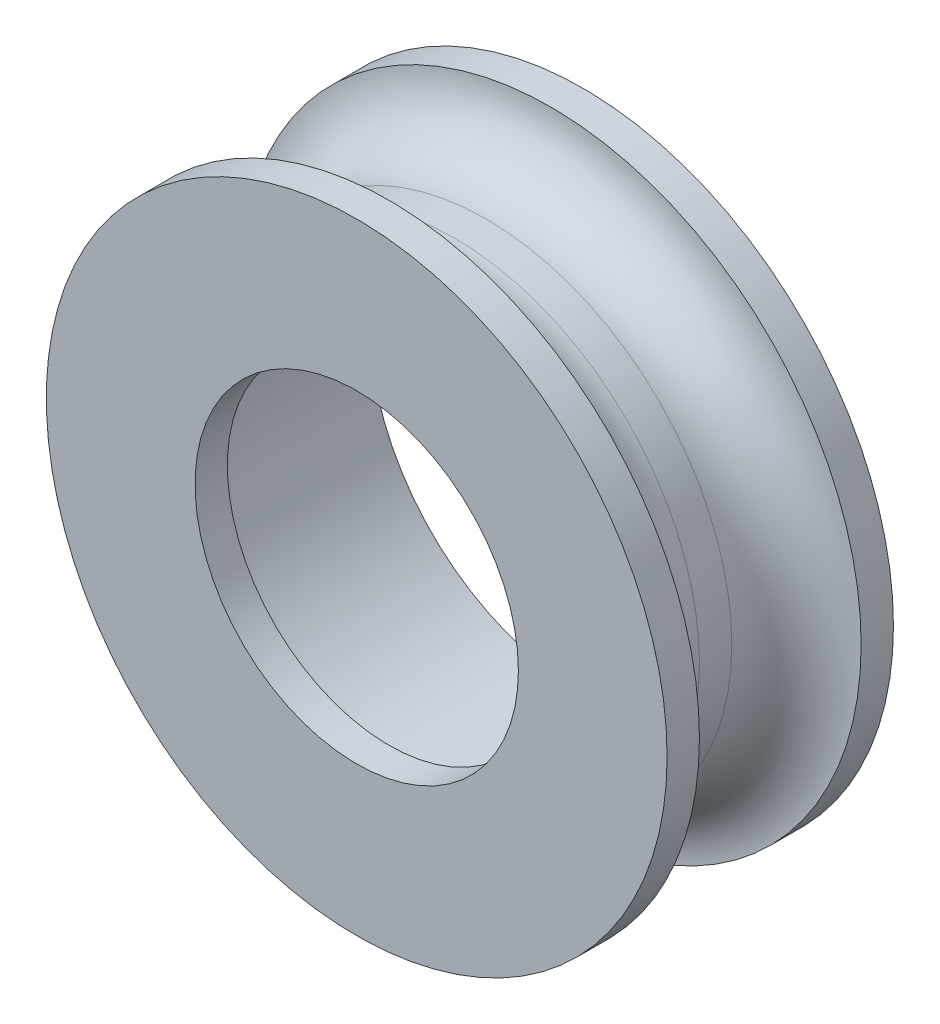
from build123d import *

# Parameters (mm, degrees)
CROQUIS1_R              = 7.6
CROQUIS1_R_2            = 6.6
SALIENTE_EXTRUIR1_DEPTH = 5
CROQUIS3_R              = 9.6
CROQUIS3_R_2            = 7.6
CROQUIS3_R_3            = 6.6
CROQUIS3_R_4            = 5
SALIENTE_EXTRUIR2_DEPTH = 1
BOSS_EXTRUDE1_START     = -6
CROQUIS3_4_R            = 9.6
CROQUIS3_4_R_2          = 7.6
CROQUIS3_4_R_3          = 6.6
BOSS_EXTRUDE1_DEPTH     = 1
REDONDEO1_R             = 2


with BuildPart() as part:
    # Croquis1 → Saliente-Extruir1 (new body)
    with BuildSketch(Plane.XY):
        Circle(CROQUIS1_R)
        Circle(CROQUIS1_R_2, mode=Mode.SUBTRACT)
    extrude(amount=SALIENTE_EXTRUIR1_DEPTH)

    # Croquis3 → Saliente-Extruir2 (add)
    # profile 1 of 3: a face of its own
    with BuildSketch(Plane.XY.offset(5)):
        Circle(CROQUIS3_R)
        Circle(CROQUIS3_R_2, mode=Mode.SUBTRACT)
    # profile 2 of 3: a face of its own
    with BuildSketch(Plane.XY.offset(5)):
        Circle(CROQUIS3_R_2)
        Circle(CROQUIS3_R_3, mode=Mode.SUBTRACT)
    # profile 3 of 3: a face of its own
    with BuildSketch(Plane.XY.offset(5)):
        Circle(CROQUIS3_R_3)
        Circle(CROQUIS3_R_4, mode=Mode.SUBTRACT)
    extrude(amount=SALIENTE_EXTRUIR2_DEPTH)

    # Croquis3<4> → Boss-Extrude1 (add)
    # profile 1 of 2: a face of its own
    with BuildSketch(Plane.XY.offset(5).offset(BOSS_EXTRUDE1_START)):
        Circle(CROQUIS3_4_R)
        Circle(CROQUIS3_4_R_2, mode=Mode.SUBTRACT)
    # profile 2 of 2: a face of its own
    with BuildSketch(Plane.XY.offset(5).offset(BOSS_EXTRUDE1_START)):
        Circle(CROQUIS3_4_R_2)
        Circle(CROQUIS3_4_R_3, mode=Mode.SUBTRACT)
    extrude(amount=BOSS_EXTRUDE1_DEPTH)

    # Redondeo1
    redondeo1_edges = [part.edges().sort_by_distance(p)[0] for p in [
        (-7.6, 0, 0),
        (-7.6, 0, 5),
    ]]
    fillet(redondeo1_edges, radius=REDONDEO1_R - 0.0001)  # a hair under: the kernel refuses the full size


solid = part.part
